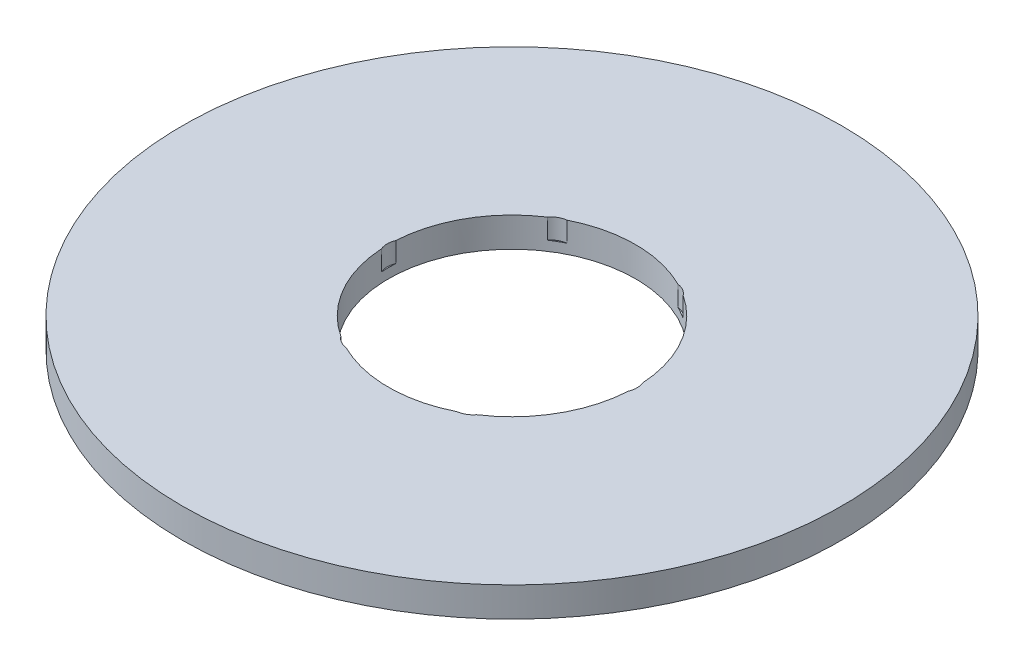
from build123d import *

# Parameters (mm, degrees)
SKETCH1_R           = 100
BOSS_EXTRUDE1_DEPTH = 9
SKETCH2_R           = 37.5
CUT_EXTRUDE1_DEPTH  = 142.707445111
SKETCH3_R           = 5.668309937
CUT_EXTRUDE2_DEPTH  = 6.068302162
CIRPATTERN1_COUNT   = 6


with BuildPart() as part:
    # Sketch1 → Boss-Extrude1 (new body)
    with BuildSketch(Plane(origin=(0, 0, 0), x_dir=(1, 0, 0), z_dir=(0, 1, 0))):
        Circle(SKETCH1_R)
    extrude(amount=BOSS_EXTRUDE1_DEPTH)

    # Sketch2 → Cut-Extrude1 (cut, through all)
    with BuildSketch(Plane(origin=(0, 0, 0), x_dir=(1, 0, 0), z_dir=(0, 1, 0))):
        Circle(SKETCH2_R)
    extrude(amount=CUT_EXTRUDE1_DEPTH, mode=Mode.SUBTRACT)

    # Sketch3 → Cut-Extrude2 (cut)
    with BuildSketch(Plane(origin=(0, 9, 0), x_dir=(1, 0, 0), z_dir=(0, 1, 0))):
        with Locations((-32.20639931, 0)):
            Circle(SKETCH3_R)
    cut_extrude2 = extrude(amount=-CUT_EXTRUDE2_DEPTH, mode=Mode.SUBTRACT)

    # CirPattern1: Cut-Extrude2 ×6 about axis
    cirpattern1_axis = Axis((0, 0, 0), (0, 1, 0))
    for i in range(1, CIRPATTERN1_COUNT):
        add(cut_extrude2.rotate(cirpattern1_axis, i * 360 / CIRPATTERN1_COUNT), mode=Mode.SUBTRACT)


solid = part.part
